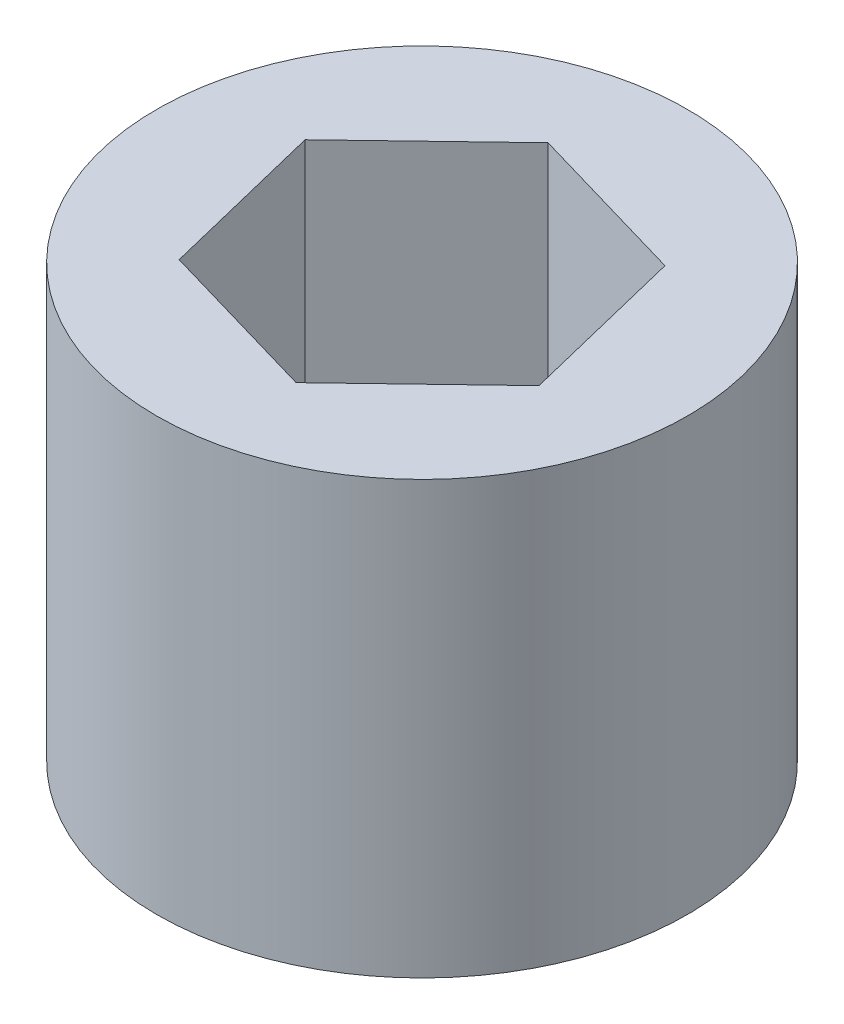
from build123d import *

# Parameters (mm, degrees)
SKETCH1_R           = 4.55
BOSS_EXTRUDE1_DEPTH = 7.4
CUT_EXTRUDE1_DEPTH  = 15


with BuildPart() as part:
    # Sketch1 → Boss-Extrude1 (new body)
    with BuildSketch(Plane(origin=(0, 0, 0), x_dir=(1, 0, 0), z_dir=(0, 1, 0))):
        Circle(SKETCH1_R)
    extrude(amount=BOSS_EXTRUDE1_DEPTH)

    # Sketch2 → Cut-Extrude1 (cut)
    with BuildSketch(Plane(origin=(0, 7.4, 0), x_dir=(1, 0, 0), z_dir=(0, 1, 0))):
        Polygon((-2.126350259, -2.036819721), (0.700762492, -2.859883202), (2.827112751, -0.823063481), (2.126350259, 2.036819721), (-0.700762492, 2.859883202), (-2.827112751, 0.823063481), align=None)
    extrude(amount=-CUT_EXTRUDE1_DEPTH, mode=Mode.SUBTRACT)


solid = part.part
